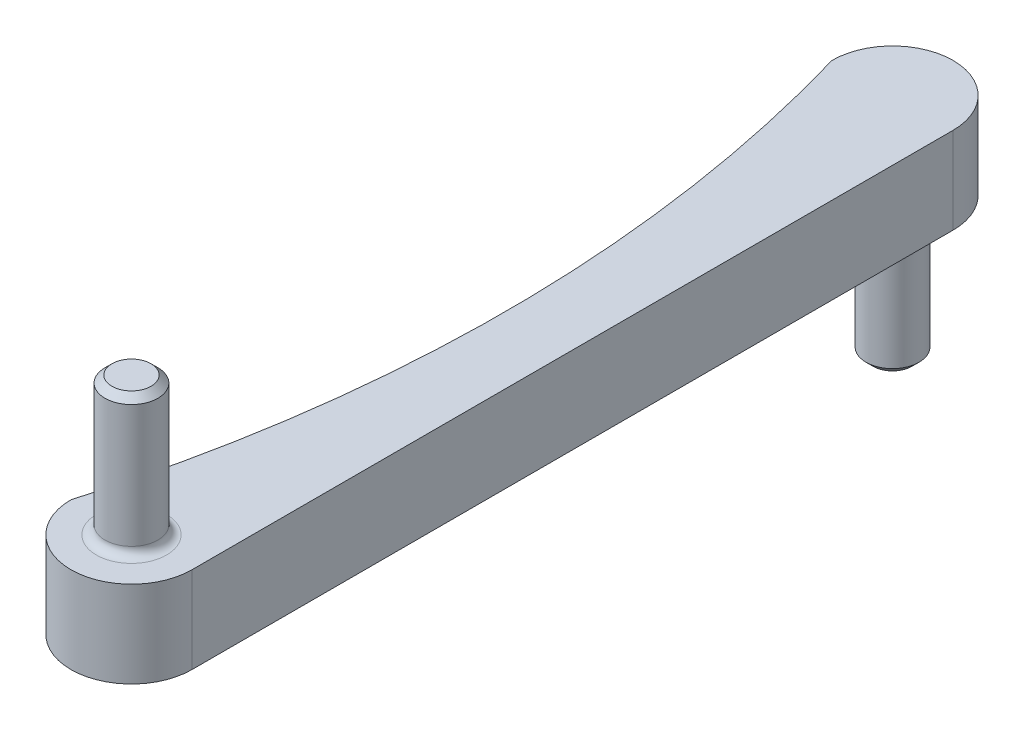
from build123d import *

# Parameters (mm, degrees)
BOSS_EXTRUDE1_DEPTH = 6.35
SKETCH3_R           = 1.9431
BOSS_EXTRUDE3_DEPTH = 10.16
SKETCH4_R           = 1.9431
BOSS_EXTRUDE4_DEPTH = 10.16
CUT_EXTRUDE1_DEPTH  = 63.701226065
FILLET2_R           = 0.635
CHAMFER4_SIZE       = 0.508


with BuildPart() as part:
    # Sketch1 → Boss-Extrude1 (new body)
    with BuildSketch(Plane(origin=(0, 0, 0), x_dir=(1, 0, 0), z_dir=(0, 1, 0))):
        with BuildLine():
            Line((-4.445, 0), (-4.445, 55.88))
            ThreePointArc((-4.445, 55.88), (0, 60.325), (4.445, 55.88))
            Line((4.445, 55.88), (4.445, 0))
            ThreePointArc((4.445, 0), (0, -4.445), (-4.445, 0))
        make_face()
    extrude(amount=BOSS_EXTRUDE1_DEPTH)

    # Sketch3 → Boss-Extrude3 (add)
    with BuildSketch(Plane(origin=(0, 6.35, 0), x_dir=(1, 0, 0), z_dir=(0, 1, 0))):
        Circle(SKETCH3_R)
    extrude(amount=BOSS_EXTRUDE3_DEPTH)

    # Sketch4 → Boss-Extrude4 (add)
    with BuildSketch(Plane.XZ):
        with Locations((0, -55.88)):
            Circle(SKETCH4_R)
    extrude(amount=BOSS_EXTRUDE4_DEPTH)

    # Sketch5 → Cut-Extrude1 (cut, through all)
    with BuildSketch(Plane(origin=(0, 6.35, 0), x_dir=(1, 0, 0), z_dir=(0, 1, 0))):
        with BuildLine():
            Line((-4.445, 55.88), (-4.445, 0))
            ThreePointArc((-4.445, 0), (-0.460821119, 27.94), (-4.445, 55.88))
        make_face()
    extrude(amount=-CUT_EXTRUDE1_DEPTH, mode=Mode.SUBTRACT)

    # Fillet2
    fillet2_edges = [part.edges().sort_by_distance(p)[0] for p in [
        (-1.9431, 0, -55.88),
        (-1.9431, 6.35, 0),
    ]]
    fillet(fillet2_edges, radius=FILLET2_R)

    # Chamfer4
    chamfer4_edges = [part.edges().sort_by_distance(p)[0] for p in [
        (-1.9431, 16.51, 0),
        (-1.9431, -10.16, -55.88),
    ]]
    chamfer(chamfer4_edges, length=CHAMFER4_SIZE)


solid = part.part
